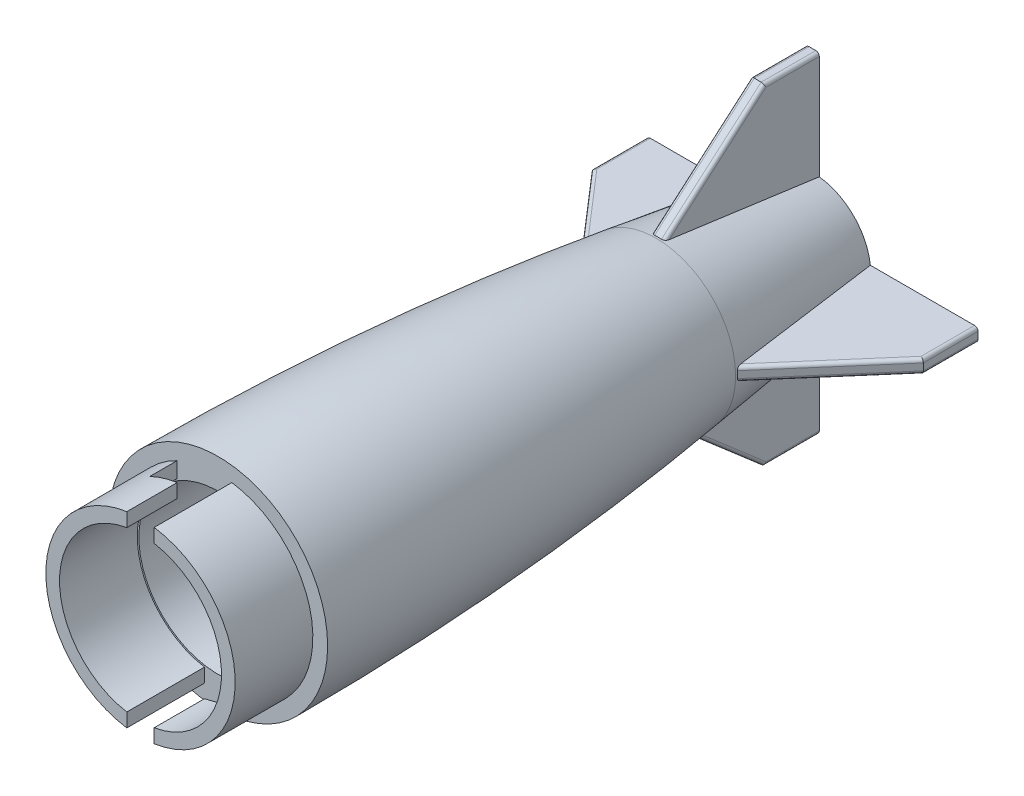
from build123d import *

# Parameters (mm, degrees)
BOSS_EXTRUDE2_DEPTH      = 0.79375
FILLET2_R                = 0.396875
CIRPATTERN5_COUNT        = 4
FILLET2_OF_CIRPATTERN5_R = 0.396875
SKETCH6_R                = 10.9855
SKETCH6_R_2              = 9.398
BOSS_EXTRUDE3_DEPTH      = 9.017
CUT_EXTRUDE1_DEPTH       = 130.007162465
CUT_EXTRUDE2_REACH       = 131.007
CUT_EXTRUDE2_END_RADIUS  = 10.9855


with BuildPart() as part:
    # Sketch3 → Revolve2 (revolve)
    with BuildSketch(Plane(origin=(0, 0, 0), x_dir=(0, 0, -1), z_dir=(1, 0, 0))):
        with BuildLine():
            Line((57.15, 12.7), (57.15, 9.2075))
            Line((57.15, 9.2075), (98.425, 9.2075))
            ThreePointArc((98.425, 9.2075), (106.155504897, 7.992781454), (113.140916579, 4.465704658))
            ThreePointArc((113.140916579, 4.465704658), (114.293963867, 3.88350757), (115.57, 3.683))
            Line((115.57, 3.683), (120.65, 3.683))
            Line((120.65, 3.683), (120.65, 2.88925))
            Line((120.65, 2.88925), (122.2375, 2.88925))
            Line((122.2375, 2.88925), (126.113769846, 6.765519846))
            Line((126.113769846, 6.765519846), (107.95, 9.246566985))
            ThreePointArc((107.95, 9.246566985), (82.608624273, 11.835646561), (57.15, 12.7))
        make_face()
    revolve(axis=Axis((0, 0, 0), (0, 0, -1)))

    # Sketch5 → Boss-Extrude2 (add, symmetric)
    with BuildSketch(Plane(origin=(0, 0, 0), x_dir=(0, 0, -1), z_dir=(1, 0, 0))):
        Polygon((126.113769846, 19.211519846), (119.763769846, 19.211519846), (107.95, 8.992566985), (126.113769846, 6.511519846), align=None)
    boss_extrude2 = extrude(amount=BOSS_EXTRUDE2_DEPTH, both=True)

    # Fillet2
    fillet2_edges = [part.edges().sort_by_distance(p)[0] for p in [
        (0.79375, 19.211519846, -122.938769846),
        (-0.79375, 19.211519846, -122.938769846),
        (0.79375, 14.1969371, -113.966588154),
        (-0.79375, 14.1969371, -113.966588154),
    ]]
    fillet(fillet2_edges, radius=FILLET2_R)

    # CirPattern5: Boss-Extrude2 ×4 about axis
    cirpattern5_axis = Axis((0, 0, -122.2375), (0, 0, 1))
    for i in range(1, CIRPATTERN5_COUNT):
        add(boss_extrude2.rotate(cirpattern5_axis, i * 360 / CIRPATTERN5_COUNT))

    # Fillet2 of CirPattern5
    fillet2_of_cirpattern5_edges = [part.edges().sort_by_distance(p)[0] for p in [
        (-19.211519846, 0.79375, -122.938769846),
        (-19.211519846, -0.79375, -122.938769846),
        (-14.1969371, 0.79375, -113.966588154),
        (-14.1969371, -0.79375, -113.966588154),
        (-0.79375, -19.211519846, -122.938769846),
        (0.79375, -19.211519846, -122.938769846),
        (-0.79375, -14.1969371, -113.966588154),
        (0.79375, -14.1969371, -113.966588154),
        (19.211519846, -0.79375, -122.938769846),
        (19.211519846, 0.79375, -122.938769846),
        (14.1969371, -0.79375, -113.966588154),
        (14.1969371, 0.79375, -113.966588154),
    ]]
    fillet(fillet2_of_cirpattern5_edges, radius=FILLET2_OF_CIRPATTERN5_R)

    # Sketch6 → Boss-Extrude3 (add)
    with BuildSketch(Plane.XY.offset(-57.15)):
        Circle(SKETCH6_R)
        Circle(SKETCH6_R_2, mode=Mode.SUBTRACT)
    extrude(amount=BOSS_EXTRUDE3_DEPTH)

    # Sketch8 → Cut-Extrude1 (cut, through all)
    with BuildSketch(Plane(origin=(0, 0, 0), x_dir=(1, 0, 0), z_dir=(0, 1, 0))):
        Polygon((-1.5875, 39.116), (1.5875, 39.116), (1.5875, 53.975), (4.7625, 53.975), (4.7625, 57.15), (-1.5875, 57.15), align=None)
    extrude(amount=-CUT_EXTRUDE1_DEPTH, mode=Mode.SUBTRACT)

    # Cut-Extrude2: up to this cylinder (the profile starts inside it)
    cut_extrude2_end = Plane(origin=(0, 0, -49.245201), z_dir=(0, 0, -1)) * Cylinder(CUT_EXTRUDE2_END_RADIUS, 284.985, mode=Mode.PRIVATE)
    # Sketch8<3> → Cut-Extrude2 (cut, up to the surface)
    with BuildSketch(Plane(origin=(0, 0, 0), x_dir=(1, 0, 0), z_dir=(0, 1, 0)), mode=Mode.PRIVATE) as cut_extrude2_sk1:
        Polygon((-1.5875, 39.116), (1.5875, 39.116), (1.5875, 57.15), (-4.7625, 57.15), (-4.7625, 53.975), (-1.5875, 53.975), align=None)
    cut_extrude2_tool1 = extrude(cut_extrude2_sk1.sketch, amount=CUT_EXTRUDE2_REACH, mode=Mode.PRIVATE) & cut_extrude2_end
    add(cut_extrude2_tool1.solids().sort_by_distance((-0.475299, 0, -49.245201))[0], mode=Mode.SUBTRACT)


solid = part.part
